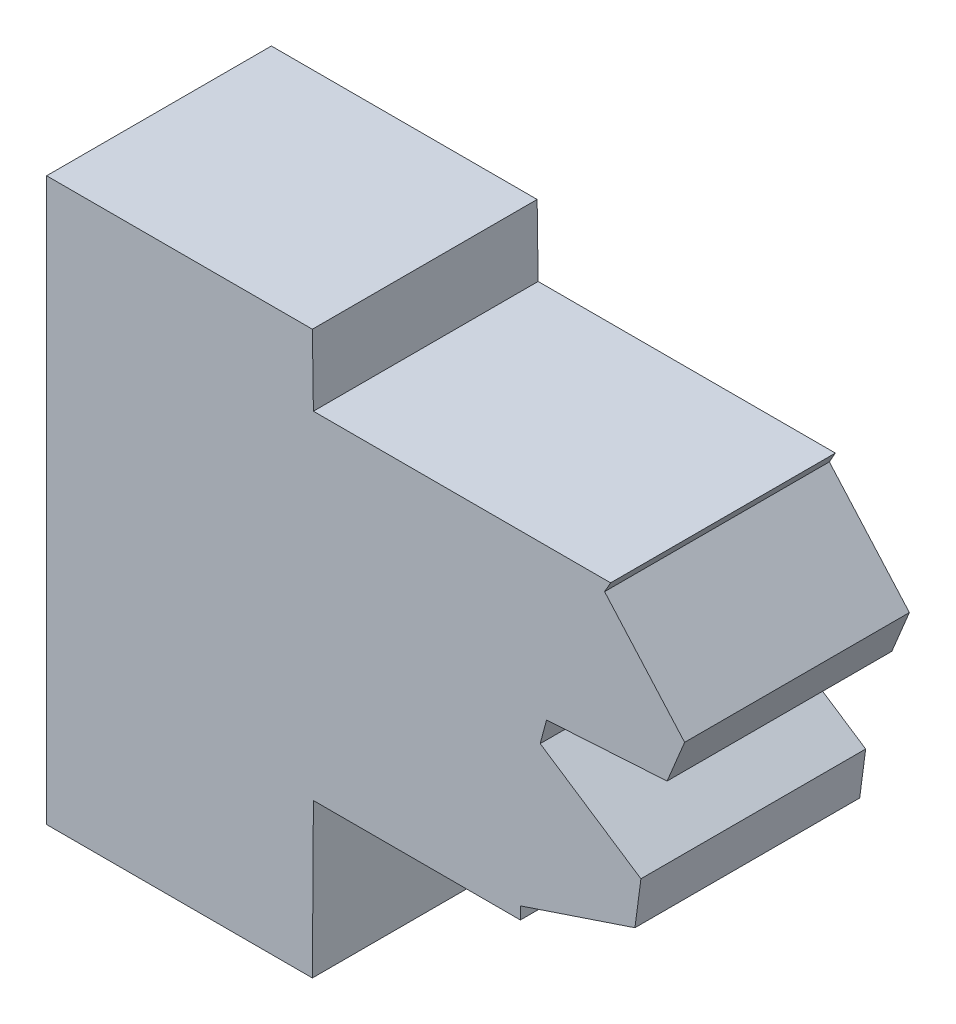
from build123d import *

# Parameters (mm, degrees)
BOSS_EXTRUDE1_DEPTH = 4


with BuildPart() as part:
    # Sketch1 → Boss-Extrude1 (new body)
    with BuildSketch(Plane.XY):
        Polygon((4.747783705, 2.744764558), (8.432074911, 2.744764558), (8.432074911, 2.962852563), (10.470675328, 3.644764558), (10.577097115, 4.453118281), (8.784452134, 5.639423302), (8.897342793, 6.060736975), (11.042971396, 6.191784769), (11.354984287, 6.945050522), (9.930460535, 8.554903841), (10.037783705, 8.744756719), (4.747783705, 8.744756719), (4.73, 10), (0, 10), (0, 0), (4.73, 0), align=None)
    extrude(amount=BOSS_EXTRUDE1_DEPTH)


solid = part.part
